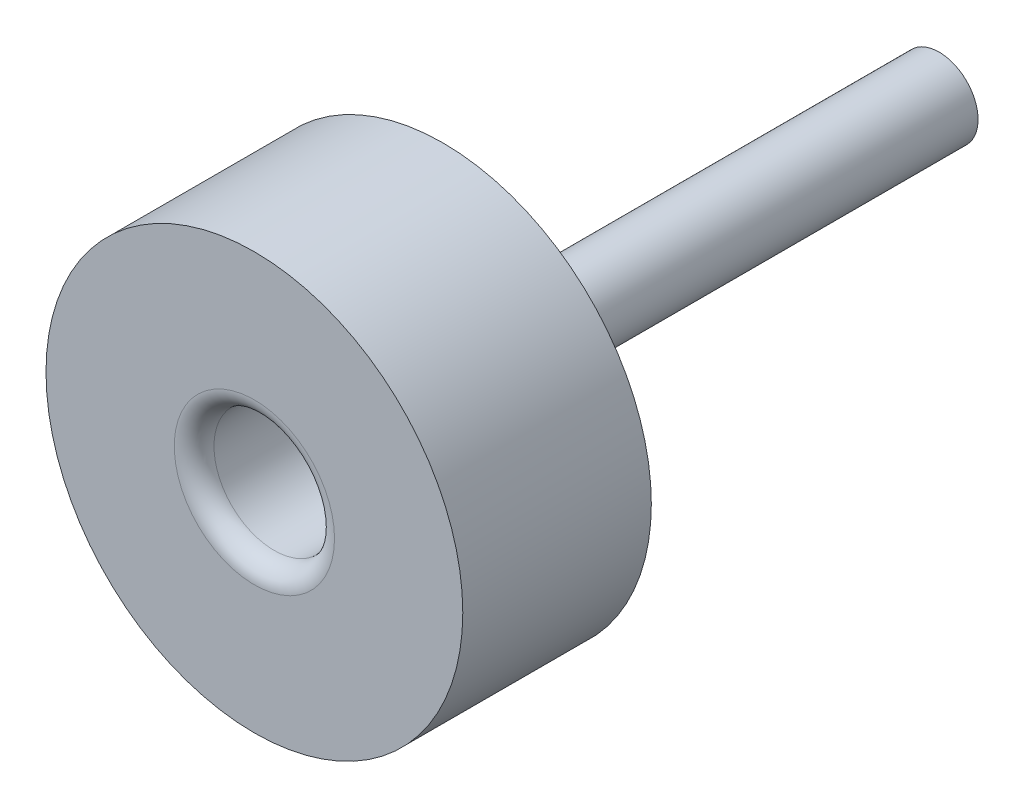
from build123d import *

# Parameters (mm, degrees)
SKIZZE1_R                       = 6
AUFSATZ_LINEAR_AUSTRAGEN1_DEPTH = 9
SKIZZE2_R                       = 3.925
AUFSATZ_LINEAR_AUSTRAGEN2_DEPTH = 41
SKIZZE3_R                       = 21
AUFSATZ_LINEAR_AUSTRAGEN3_DEPTH = 19
SKIZZE4_R                       = 6.075
SCHNITT_LINEAR_AUSTRAGEN2_DEPTH = 10
VERRUNDUNG1_R                   = 2


with BuildPart() as part:
    # Skizze1 → Aufsatz-Linear austragen1 (new body)
    with BuildSketch(Plane.XY):
        Circle(SKIZZE1_R)
    extrude(amount=AUFSATZ_LINEAR_AUSTRAGEN1_DEPTH)

    # Skizze2 → Aufsatz-Linear austragen2 (add)
    with BuildSketch(Plane(origin=(0, 0, 0), x_dir=(-1, 0, 0), z_dir=(0, 0, -1))):
        Circle(SKIZZE2_R)
    extrude(amount=AUFSATZ_LINEAR_AUSTRAGEN2_DEPTH)

    # Skizze3 → Aufsatz-Linear austragen3 (add)
    with BuildSketch(Plane.XY.offset(9)):
        Circle(SKIZZE3_R)
    extrude(amount=AUFSATZ_LINEAR_AUSTRAGEN3_DEPTH)

    # Skizze4 → Schnitt-Linear austragen2 (cut)
    with BuildSketch(Plane.XY.offset(28)):
        Circle(SKIZZE4_R)
    extrude(amount=-SCHNITT_LINEAR_AUSTRAGEN2_DEPTH, mode=Mode.SUBTRACT)

    # Verrundung1
    verrundung1_edges = [part.edges().sort_by_distance(p)[0] for p in [
        (-6.075, 0, 28),
    ]]
    fillet(verrundung1_edges, radius=VERRUNDUNG1_R)


solid = part.part
